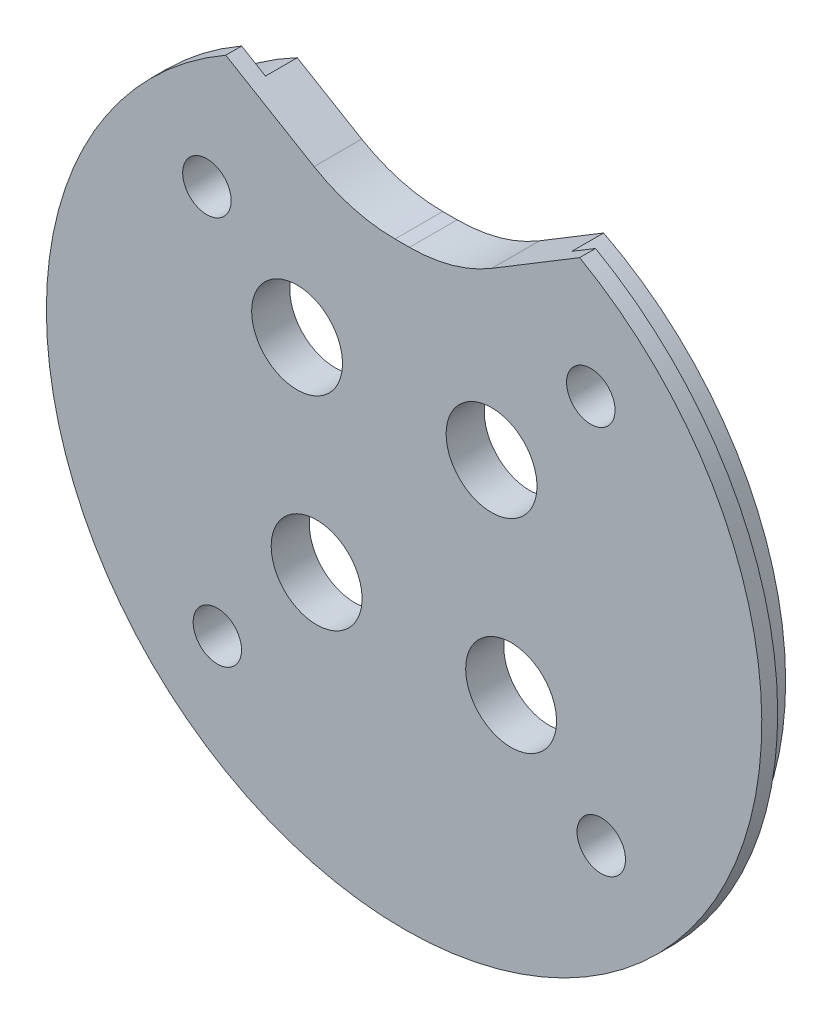
from build123d import *

# Parameters (mm, degrees)
SKETCH1_R           = 21
BOSS_EXTRUDE1_DEPTH = 2
SKETCH2_R           = 22.5
BOSS_EXTRUDE2_DEPTH = 1
CUT_EXTRUDE1_DEPTH  = 0.6
CUT_EXTRUDE2_REACH  = 33.961
SKETCH4_R           = 1.524
SKETCH4_R_2         = 2.8575


with BuildPart() as part:
    # Sketch1 → Boss-Extrude1 (new body)
    with BuildSketch(Plane.XY):
        Circle(SKETCH1_R)
    extrude(amount=BOSS_EXTRUDE1_DEPTH)

    # Sketch2 → Boss-Extrude2 (add)
    with BuildSketch(Plane.XY.offset(2)):
        Circle(SKETCH2_R)
    extrude(amount=BOSS_EXTRUDE2_DEPTH)

    # Sketch3 → Cut-Extrude1 (cut)
    with BuildSketch(Plane(origin=(0, 0, 0), x_dir=(-1, 0, 0), z_dir=(0, 0, -1))):
        with BuildLine():
            Line((14.657141195, 13.705060999), (14.482492144, 13.889489058))
            ThreePointArc((14.482492144, 13.889489058), (11.90854993, 15.038712782), (9.275874048, 14.031284676))
            Line((9.275874048, 14.031284676), (2.820891979, 7.918567891))
            ThreePointArc((2.820891979, 7.918567891), (0.188216097, 6.911139785), (-2.385726118, 8.060363509))
            Line((-2.385726118, 8.060363509), (-8.498442902, 14.515345578))
            ThreePointArc((-8.498442902, 14.515345578), (-11.072385117, 15.664569301), (-13.705060999, 14.657141195))
            Line((-13.705060999, 14.657141195), (-13.889489058, 14.482492144))
            ThreePointArc((-13.889489058, 14.482492144), (-15.038712782, 11.90854993), (-14.031284676, 9.275874048))
            Line((-14.031284676, 9.275874048), (-7.918567891, 2.820891979))
            ThreePointArc((-7.918567891, 2.820891979), (-6.911139785, 0.188216097), (-8.060363509, -2.385726118))
            Line((-8.060363509, -2.385726118), (-14.515345578, -8.498442902))
            ThreePointArc((-14.515345578, -8.498442902), (-15.664569301, -11.072385117), (-14.657141195, -13.705060999))
            Line((-14.657141195, -13.705060999), (-14.482492144, -13.889489058))
            ThreePointArc((-14.482492144, -13.889489058), (-11.90854993, -15.038712782), (-9.275874048, -14.031284676))
            Line((-9.275874048, -14.031284676), (-2.820891979, -7.918567891))
            ThreePointArc((-2.820891979, -7.918567891), (-0.188216097, -6.911139785), (2.385726118, -8.060363509))
            Line((2.385726118, -8.060363509), (8.498442902, -14.515345578))
            ThreePointArc((8.498442902, -14.515345578), (11.072385117, -15.664569301), (13.705060999, -14.657141195))
            Line((13.705060999, -14.657141195), (13.889489058, -14.482492144))
            ThreePointArc((13.889489058, -14.482492144), (15.038712782, -11.90854993), (14.031284676, -9.275874048))
            Line((14.031284676, -9.275874048), (7.918567891, -2.820891979))
            ThreePointArc((7.918567891, -2.820891979), (6.911139785, -0.188216097), (8.060363509, 2.385726118))
            Line((8.060363509, 2.385726118), (14.515345578, 8.498442902))
            ThreePointArc((14.515345578, 8.498442902), (15.664569301, 11.072385117), (14.657141195, 13.705060999))
        make_face()
    extrude(amount=-CUT_EXTRUDE1_DEPTH, mode=Mode.SUBTRACT)

    # Sketch4 → Cut-Extrude2 (cut, up to next)
    with BuildSketch(Plane(origin=(0, 0, 0), x_dir=(-1, 0, 0), z_dir=(0, 0, -1)), mode=Mode.PRIVATE) as cut_extrude2_sk1:
        with Locations((12.402786975, 11.745148679)):
            Circle(SKETCH4_R)
    cut_extrude2_tool1 = extrude(cut_extrude2_sk1.sketch, amount=-CUT_EXTRUDE2_REACH, mode=Mode.PRIVATE) & part.part
    # Sketch4 → Cut-Extrude2 (cut, up to next)
    with BuildSketch(Plane(origin=(0, 0, 0), x_dir=(-1, 0, 0), z_dir=(0, 0, -1)), mode=Mode.PRIVATE) as cut_extrude2_sk2:
        with Locations((11.745148679, -12.402786975)):
            Circle(SKETCH4_R)
    cut_extrude2_tool2 = extrude(cut_extrude2_sk2.sketch, amount=-CUT_EXTRUDE2_REACH, mode=Mode.PRIVATE) & part.part
    # Sketch4 → Cut-Extrude2 (cut, up to next)
    with BuildSketch(Plane(origin=(0, 0, 0), x_dir=(-1, 0, 0), z_dir=(0, 0, -1)), mode=Mode.PRIVATE) as cut_extrude2_sk3:
        with Locations((-12.402786975, -11.745148679)):
            Circle(SKETCH4_R)
    cut_extrude2_tool3 = extrude(cut_extrude2_sk3.sketch, amount=-CUT_EXTRUDE2_REACH, mode=Mode.PRIVATE) & part.part
    # Sketch4 → Cut-Extrude2 (cut, up to next)
    with BuildSketch(Plane(origin=(0, 0, 0), x_dir=(-1, 0, 0), z_dir=(0, 0, -1)), mode=Mode.PRIVATE) as cut_extrude2_sk4:
        with Locations((-11.745148679, 12.402786975)):
            Circle(SKETCH4_R)
    cut_extrude2_tool4 = extrude(cut_extrude2_sk4.sketch, amount=-CUT_EXTRUDE2_REACH, mode=Mode.PRIVATE) & part.part
    # Sketch4 → Cut-Extrude2 (cut, up to next)
    with BuildSketch(Plane(origin=(0, 0, 0), x_dir=(-1, 0, 0), z_dir=(0, 0, -1)), mode=Mode.PRIVATE) as cut_extrude2_sk5:
        with Locations((-5.501445106, 5.809483862)):
            Circle(SKETCH4_R_2)
    cut_extrude2_tool5 = extrude(cut_extrude2_sk5.sketch, amount=-CUT_EXTRUDE2_REACH, mode=Mode.PRIVATE) & part.part
    # Sketch4 → Cut-Extrude2 (cut, up to next)
    with BuildSketch(Plane(origin=(0, 0, 0), x_dir=(-1, 0, 0), z_dir=(0, 0, -1)), mode=Mode.PRIVATE) as cut_extrude2_sk6:
        with Locations((6.731624158, 6.374690361)):
            Circle(SKETCH4_R_2)
    cut_extrude2_tool6 = extrude(cut_extrude2_sk6.sketch, amount=-CUT_EXTRUDE2_REACH, mode=Mode.PRIVATE) & part.part
    # Sketch4 → Cut-Extrude2 (cut, up to next)
    with BuildSketch(Plane(origin=(0, 0, 0), x_dir=(-1, 0, 0), z_dir=(0, 0, -1)), mode=Mode.PRIVATE) as cut_extrude2_sk7:
        with Locations((5.501445106, -5.809483862)):
            Circle(SKETCH4_R_2)
    cut_extrude2_tool7 = extrude(cut_extrude2_sk7.sketch, amount=-CUT_EXTRUDE2_REACH, mode=Mode.PRIVATE) & part.part
    # Sketch4 → Cut-Extrude2 (cut, up to next)
    with BuildSketch(Plane(origin=(0, 0, 0), x_dir=(-1, 0, 0), z_dir=(0, 0, -1)), mode=Mode.PRIVATE) as cut_extrude2_sk8:
        with Locations((-6.731624158, -6.374690361)):
            Circle(SKETCH4_R_2)
    cut_extrude2_tool8 = extrude(cut_extrude2_sk8.sketch, amount=-CUT_EXTRUDE2_REACH, mode=Mode.PRIVATE) & part.part
    # Sketch4 → Cut-Extrude2 (cut, up to next)
    with BuildSketch(Plane(origin=(0, 0, 0), x_dir=(-1, 0, 0), z_dir=(0, 0, -1)), mode=Mode.PRIVATE) as cut_extrude2_sk9:
        with BuildLine():
            Line((-11.040615308, 19.604969105), (-5.51854435, 16.261312284))
            ThreePointArc((-5.51854435, 16.261312284), (-3.027783619, 15.183648482), (-0.338986288, 14.815386067))
            Line((-0.338986288, 14.815386067), (0.567529778, 14.815386067))
            ThreePointArc((0.567529778, 14.815386067), (3.210473763, 15.170965551), (5.665462417, 16.212416649))
            Line((5.665462417, 16.212416649), (11.219097888, 19.503380286))
            ThreePointArc((11.219097888, 19.503380286), (0.10268437, 22.499765686), (-11.040615308, 19.604969105))
        make_face()
    cut_extrude2_tool9 = extrude(cut_extrude2_sk9.sketch, amount=-CUT_EXTRUDE2_REACH, mode=Mode.PRIVATE) & part.part
    add(cut_extrude2_tool1.solids().sort_by_distance((-12.402787, 11.745149, 0))[0], mode=Mode.SUBTRACT)
    add(cut_extrude2_tool2.solids().sort_by_distance((-11.745149, -12.402787, 0))[0], mode=Mode.SUBTRACT)
    add(cut_extrude2_tool3.solids().sort_by_distance((12.402787, -11.745149, 0))[0], mode=Mode.SUBTRACT)
    add(cut_extrude2_tool4.solids().sort_by_distance((11.745149, 12.402787, 0))[0], mode=Mode.SUBTRACT)
    add(cut_extrude2_tool5.solids().sort_by_distance((5.501445, 5.809484, 0))[0], mode=Mode.SUBTRACT)
    add(cut_extrude2_tool6.solids().sort_by_distance((-6.731624, 6.37469, 0))[0], mode=Mode.SUBTRACT)
    add(cut_extrude2_tool7.solids().sort_by_distance((-5.501445, -5.809484, 0))[0], mode=Mode.SUBTRACT)
    add(cut_extrude2_tool8.solids().sort_by_distance((6.731624, -6.37469, 0))[0], mode=Mode.SUBTRACT)
    add(cut_extrude2_tool9.solids().sort_by_distance((-0.08522, 18.896567, 0))[0], mode=Mode.SUBTRACT)


solid = part.part
